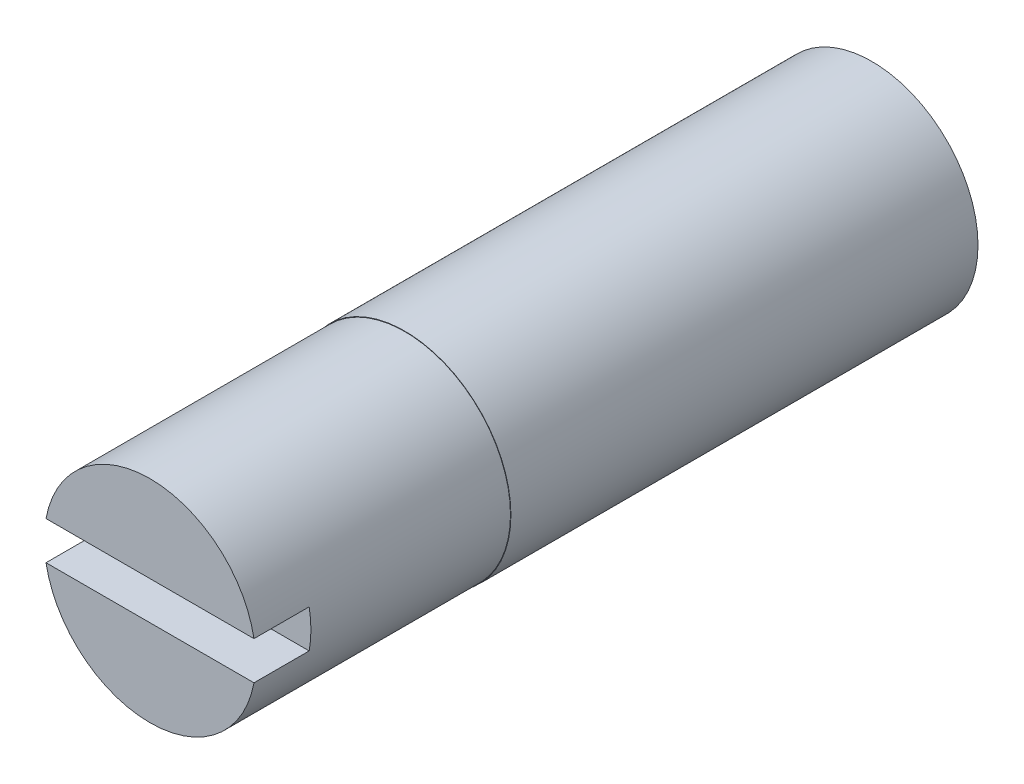
from build123d import *

# Parameters (mm, degrees)
SKETCH_1_R          = 2.49
EXTRUDE_1_DEPTH     = 6
SKETCH_8_W          = 5
SKETCH_8_H          = 0.9
CUT_EXTRUDE_2_DEPTH = 1.3
SKETCH_9_R          = 2.5
EXTRUDE_2_DEPTH     = 11


with BuildPart() as part:
    # 草圖1 → 填料-伸長1 (new body)
    with BuildSketch(Plane.XY):
        Circle(SKETCH_1_R)
    extrude(amount=EXTRUDE_1_DEPTH)

    # 草圖8 → 除料-伸長2 (cut)
    with BuildSketch(Plane.XY.offset(6)):
        Rectangle(SKETCH_8_W, SKETCH_8_H)
    extrude(amount=-CUT_EXTRUDE_2_DEPTH, mode=Mode.SUBTRACT)

    # 草圖9 → 填料-伸長2 (add)
    with BuildSketch(Plane(origin=(0, 0, 0), x_dir=(-1, 0, 0), z_dir=(0, 0, -1))):
        Circle(SKETCH_9_R)
    extrude(amount=EXTRUDE_2_DEPTH)


solid = part.part
